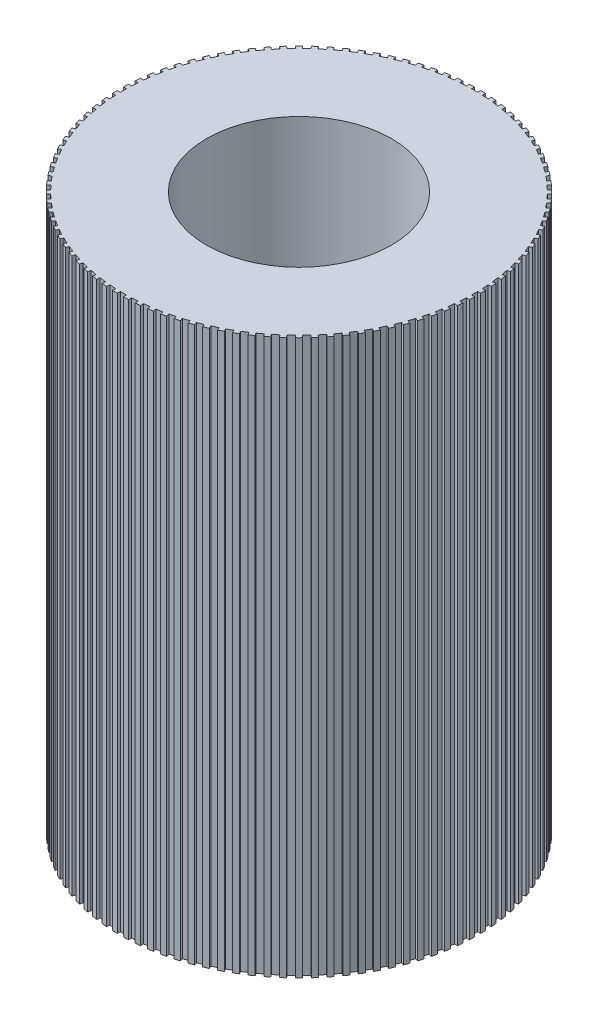
from build123d import *

# Parameters (mm, degrees)
SKETCH_1_R          = 2.9
SKETCH_1_R_2        = 1.5
EXTRUDE_1_DEPTH     = 9
SKETCH_2_W          = 0.1
SKETCH_2_H          = 0.1
CUT_EXTRUDE_1_DEPTH = 9


with BuildPart() as part:
    # 草图1 → 凸台-拉伸1 (new body)
    with BuildSketch(Plane(origin=(0, 0, 0), x_dir=(1, 0, 0), z_dir=(0, 1, 0))):
        Circle(SKETCH_1_R)
        Circle(SKETCH_1_R_2, mode=Mode.SUBTRACT)
    extrude(amount=EXTRUDE_1_DEPTH)

    # 草图2 → 切除-拉伸1 (cut)
    with BuildSketch(Plane(origin=(0, 9, 0), x_dir=(1, 0, 0), z_dir=(0, 1, 0))):
        Polygon((0.135330696, 2.947318375), (0.235133369, 2.941039323), (0.228854317, 2.84123665), (0.129051644, 2.847515702), align=None)
        with Locations((0, 2.9)):
            Rectangle(SKETCH_2_W, SKETCH_2_H)
        Polygon((0.320127304, 2.933005031), (0.419338774, 2.920471707), (0.406805451, 2.821260237), (0.307593981, 2.83379356), align=None)
        Polygon((0.503660515, 2.907116455), (0.601889241, 2.888378324), (0.583151109, 2.790149599), (0.484922384, 2.80888773), align=None)
        Polygon((0.685206009, 2.86975482), (0.782064325, 2.844885831), (0.757195336, 2.748027515), (0.66033702, 2.772896504), align=None)
        Polygon((0.864047308, 2.821067573), (0.959152959, 2.790165873), (0.92825126, 2.695060222), (0.833145608, 2.725961921), align=None)
        Polygon((1.039478606, 2.761246861), (1.132456255, 2.724434406), (1.095643799, 2.631456757), (1.002666151, 2.668269212), align=None)
        Polygon((1.210807557, 2.690528769), (1.301290263, 2.64795084), (1.258712334, 2.557468135), (1.168229628, 2.600046064), align=None)
        Polygon((1.377358005, 2.60919239), (1.464988673, 2.561017022), (1.416813305, 2.473386354), (1.329182637, 2.521561722), align=None)
        Polygon((1.538472649, 2.51755872), (1.622905441, 2.46397604), (1.569322762, 2.379543248), (1.484889969, 2.433125927), align=None)
        Polygon((1.693515645, 2.415989396), (1.774417344, 2.357210871), (1.715638819, 2.276309171), (1.634737119, 2.335087697), align=None)
        Polygon((1.841875108, 2.304885266), (1.918926432, 2.241142867), (1.855184033, 2.164091542), (1.778132709, 2.227833941), align=None)
        Polygon((1.982965531, 2.184684806), (2.055862394, 2.116230096), (1.987407683, 2.043333233), (1.914510821, 2.111787943), align=None)
        Polygon((2.116230096, 2.055862394), (2.184684806, 1.982965531), (2.111787943, 1.914510821), (2.043333233, 1.987407683), align=None)
        Polygon((2.241142867, 1.918926432), (2.304885266, 1.841875108), (2.227833941, 1.778132709), (2.164091542, 1.855184033), align=None)
        Polygon((2.357210871, 1.774417344), (2.415989396, 1.693515645), (2.335087697, 1.634737119), (2.276309171, 1.715638819), align=None)
        Polygon((2.46397604, 1.622905441), (2.51755872, 1.538472649), (2.433125927, 1.484889969), (2.379543248, 1.569322762), align=None)
        Polygon((2.561017022, 1.464988673), (2.60919239, 1.377358005), (2.521561722, 1.329182637), (2.473386354, 1.416813305), align=None)
        Polygon((2.64795084, 1.301290263), (2.690528769, 1.210807557), (2.600046064, 1.168229628), (2.557468135, 1.258712334), align=None)
        Polygon((2.724434406, 1.132456255), (2.761246861, 1.039478606), (2.668269212, 1.002666151), (2.631456757, 1.095643799), align=None)
        Polygon((2.790165873, 0.959152959), (2.821067573, 0.864047308), (2.725961921, 0.833145608), (2.695060222, 0.92825126), align=None)
        Polygon((2.844885831, 0.782064325), (2.86975482, 0.685206009), (2.772896504, 0.66033702), (2.748027515, 0.757195336), align=None)
        Polygon((2.888378324, 0.601889241), (2.907116455, 0.503660515), (2.80888773, 0.484922384), (2.790149599, 0.583151109), align=None)
        Polygon((2.920471707, 0.419338774), (2.933005031, 0.320127304), (2.83379356, 0.307593981), (2.821260237, 0.406805451), align=None)
        Polygon((2.941039323, 0.235133369), (2.947318375, 0.135330696), (2.847515702, 0.129051644), (2.84123665, 0.228854317), align=None)
        with Locations((2.9, 0)):
            Rectangle(SKETCH_2_W, SKETCH_2_H)
        Polygon((2.947318375, -0.135330696), (2.941039323, -0.235133369), (2.84123665, -0.228854317), (2.847515702, -0.129051644), align=None)
        Polygon((2.933005031, -0.320127304), (2.920471707, -0.419338774), (2.821260237, -0.406805451), (2.83379356, -0.307593981), align=None)
        Polygon((2.907116455, -0.503660515), (2.888378324, -0.601889241), (2.790149599, -0.583151109), (2.80888773, -0.484922384), align=None)
        Polygon((2.86975482, -0.685206009), (2.844885831, -0.782064325), (2.748027515, -0.757195336), (2.772896504, -0.66033702), align=None)
        Polygon((2.821067573, -0.864047308), (2.790165873, -0.959152959), (2.695060222, -0.92825126), (2.725961921, -0.833145608), align=None)
        Polygon((2.761246861, -1.039478606), (2.724434406, -1.132456255), (2.631456757, -1.095643799), (2.668269212, -1.002666151), align=None)
        Polygon((2.690528769, -1.210807557), (2.64795084, -1.301290263), (2.557468135, -1.258712334), (2.600046064, -1.168229628), align=None)
        Polygon((2.60919239, -1.377358005), (2.561017022, -1.464988673), (2.473386354, -1.416813305), (2.521561722, -1.329182637), align=None)
        Polygon((2.51755872, -1.538472649), (2.46397604, -1.622905441), (2.379543248, -1.569322762), (2.433125927, -1.484889969), align=None)
        Polygon((2.415989396, -1.693515645), (2.357210871, -1.774417344), (2.276309171, -1.715638819), (2.335087697, -1.634737119), align=None)
        Polygon((2.304885266, -1.841875108), (2.241142867, -1.918926432), (2.164091542, -1.855184033), (2.227833941, -1.778132709), align=None)
        Polygon((2.184684806, -1.982965531), (2.116230096, -2.055862394), (2.043333233, -1.987407683), (2.111787943, -1.914510821), align=None)
        Polygon((2.055862394, -2.116230096), (1.982965531, -2.184684806), (1.914510821, -2.111787943), (1.987407683, -2.043333233), align=None)
        Polygon((1.918926432, -2.241142867), (1.841875108, -2.304885266), (1.778132709, -2.227833941), (1.855184033, -2.164091542), align=None)
        Polygon((1.774417344, -2.357210871), (1.693515645, -2.415989396), (1.634737119, -2.335087697), (1.715638819, -2.276309171), align=None)
        Polygon((1.622905441, -2.46397604), (1.538472649, -2.51755872), (1.484889969, -2.433125927), (1.569322762, -2.379543248), align=None)
        Polygon((1.464988673, -2.561017022), (1.377358005, -2.60919239), (1.329182637, -2.521561722), (1.416813305, -2.473386354), align=None)
        Polygon((1.301290263, -2.64795084), (1.210807557, -2.690528769), (1.168229628, -2.600046064), (1.258712334, -2.557468135), align=None)
        Polygon((1.132456255, -2.724434406), (1.039478606, -2.761246861), (1.002666151, -2.668269212), (1.095643799, -2.631456757), align=None)
        Polygon((0.959152959, -2.790165873), (0.864047308, -2.821067573), (0.833145608, -2.725961921), (0.92825126, -2.695060222), align=None)
        Polygon((0.782064325, -2.844885831), (0.685206009, -2.86975482), (0.66033702, -2.772896504), (0.757195336, -2.748027515), align=None)
        Polygon((0.601889241, -2.888378324), (0.503660515, -2.907116455), (0.484922384, -2.80888773), (0.583151109, -2.790149599), align=None)
        Polygon((0.419338774, -2.920471707), (0.320127304, -2.933005031), (0.307593981, -2.83379356), (0.406805451, -2.821260237), align=None)
        Polygon((0.235133369, -2.941039323), (0.135330696, -2.947318375), (0.129051644, -2.847515702), (0.228854317, -2.84123665), align=None)
        with Locations((0, -2.9)):
            Rectangle(SKETCH_2_W, SKETCH_2_H)
        Polygon((-0.135330696, -2.947318375), (-0.235133369, -2.941039323), (-0.228854317, -2.84123665), (-0.129051644, -2.847515702), align=None)
        Polygon((-0.320127304, -2.933005031), (-0.419338774, -2.920471707), (-0.406805451, -2.821260237), (-0.307593981, -2.83379356), align=None)
        Polygon((-0.503660515, -2.907116455), (-0.601889241, -2.888378324), (-0.583151109, -2.790149599), (-0.484922384, -2.80888773), align=None)
        Polygon((-0.685206009, -2.86975482), (-0.782064325, -2.844885831), (-0.757195336, -2.748027515), (-0.66033702, -2.772896504), align=None)
        Polygon((-0.864047308, -2.821067573), (-0.959152959, -2.790165873), (-0.92825126, -2.695060222), (-0.833145608, -2.725961921), align=None)
        Polygon((-1.039478606, -2.761246861), (-1.132456255, -2.724434406), (-1.095643799, -2.631456757), (-1.002666151, -2.668269212), align=None)
        Polygon((-1.210807557, -2.690528769), (-1.301290263, -2.64795084), (-1.258712334, -2.557468135), (-1.168229628, -2.600046064), align=None)
        Polygon((-1.377358005, -2.60919239), (-1.464988673, -2.561017022), (-1.416813305, -2.473386354), (-1.329182637, -2.521561722), align=None)
        Polygon((-1.538472649, -2.51755872), (-1.622905441, -2.46397604), (-1.569322762, -2.379543248), (-1.484889969, -2.433125927), align=None)
        Polygon((-1.693515645, -2.415989396), (-1.774417344, -2.357210871), (-1.715638819, -2.276309171), (-1.634737119, -2.335087697), align=None)
        Polygon((-1.841875108, -2.304885266), (-1.918926432, -2.241142867), (-1.855184033, -2.164091542), (-1.778132709, -2.227833941), align=None)
        Polygon((-1.982965531, -2.184684806), (-2.055862394, -2.116230096), (-1.987407683, -2.043333233), (-1.914510821, -2.111787943), align=None)
        Polygon((-2.116230096, -2.055862394), (-2.184684806, -1.982965531), (-2.111787943, -1.914510821), (-2.043333233, -1.987407683), align=None)
        Polygon((-2.241142867, -1.918926432), (-2.304885266, -1.841875108), (-2.227833941, -1.778132709), (-2.164091542, -1.855184033), align=None)
        Polygon((-2.357210871, -1.774417344), (-2.415989396, -1.693515645), (-2.335087697, -1.634737119), (-2.276309171, -1.715638819), align=None)
        Polygon((-2.46397604, -1.622905441), (-2.51755872, -1.538472649), (-2.433125927, -1.484889969), (-2.379543248, -1.569322762), align=None)
        Polygon((-2.561017022, -1.464988673), (-2.60919239, -1.377358005), (-2.521561722, -1.329182637), (-2.473386354, -1.416813305), align=None)
        Polygon((-2.64795084, -1.301290263), (-2.690528769, -1.210807557), (-2.600046064, -1.168229628), (-2.557468135, -1.258712334), align=None)
        Polygon((-2.724434406, -1.132456255), (-2.761246861, -1.039478606), (-2.668269212, -1.002666151), (-2.631456757, -1.095643799), align=None)
        Polygon((-2.790165873, -0.959152959), (-2.821067573, -0.864047308), (-2.725961921, -0.833145608), (-2.695060222, -0.92825126), align=None)
        Polygon((-2.844885831, -0.782064325), (-2.86975482, -0.685206009), (-2.772896504, -0.66033702), (-2.748027515, -0.757195336), align=None)
        Polygon((-2.888378324, -0.601889241), (-2.907116455, -0.503660515), (-2.80888773, -0.484922384), (-2.790149599, -0.583151109), align=None)
        Polygon((-2.920471707, -0.419338774), (-2.933005031, -0.320127304), (-2.83379356, -0.307593981), (-2.821260237, -0.406805451), align=None)
        Polygon((-2.941039323, -0.235133369), (-2.947318375, -0.135330696), (-2.847515702, -0.129051644), (-2.84123665, -0.228854317), align=None)
        with Locations((-2.9, 0)):
            Rectangle(SKETCH_2_W, SKETCH_2_H)
        Polygon((-2.947318375, 0.135330696), (-2.941039323, 0.235133369), (-2.84123665, 0.228854317), (-2.847515702, 0.129051644), align=None)
        Polygon((-2.933005031, 0.320127304), (-2.920471707, 0.419338774), (-2.821260237, 0.406805451), (-2.83379356, 0.307593981), align=None)
        Polygon((-2.907116455, 0.503660515), (-2.888378324, 0.601889241), (-2.790149599, 0.583151109), (-2.80888773, 0.484922384), align=None)
        Polygon((-2.86975482, 0.685206009), (-2.844885831, 0.782064325), (-2.748027515, 0.757195336), (-2.772896504, 0.66033702), align=None)
        Polygon((-2.821067573, 0.864047308), (-2.790165873, 0.959152959), (-2.695060222, 0.92825126), (-2.725961921, 0.833145608), align=None)
        Polygon((-2.761246861, 1.039478606), (-2.724434406, 1.132456255), (-2.631456757, 1.095643799), (-2.668269212, 1.002666151), align=None)
        Polygon((-2.690528769, 1.210807557), (-2.64795084, 1.301290263), (-2.557468135, 1.258712334), (-2.600046064, 1.168229628), align=None)
        Polygon((-2.60919239, 1.377358005), (-2.561017022, 1.464988673), (-2.473386354, 1.416813305), (-2.521561722, 1.329182637), align=None)
        Polygon((-2.51755872, 1.538472649), (-2.46397604, 1.622905441), (-2.379543248, 1.569322762), (-2.433125927, 1.484889969), align=None)
        Polygon((-2.415989396, 1.693515645), (-2.357210871, 1.774417344), (-2.276309171, 1.715638819), (-2.335087697, 1.634737119), align=None)
        Polygon((-2.304885266, 1.841875108), (-2.241142867, 1.918926432), (-2.164091542, 1.855184033), (-2.227833941, 1.778132709), align=None)
        Polygon((-2.184684806, 1.982965531), (-2.116230096, 2.055862394), (-2.043333233, 1.987407683), (-2.111787943, 1.914510821), align=None)
        Polygon((-2.055862394, 2.116230096), (-1.982965531, 2.184684806), (-1.914510821, 2.111787943), (-1.987407683, 2.043333233), align=None)
        Polygon((-1.918926432, 2.241142867), (-1.841875108, 2.304885266), (-1.778132709, 2.227833941), (-1.855184033, 2.164091542), align=None)
        Polygon((-1.774417344, 2.357210871), (-1.693515645, 2.415989396), (-1.634737119, 2.335087697), (-1.715638819, 2.276309171), align=None)
        Polygon((-1.622905441, 2.46397604), (-1.538472649, 2.51755872), (-1.484889969, 2.433125927), (-1.569322762, 2.379543248), align=None)
        Polygon((-1.464988673, 2.561017022), (-1.377358005, 2.60919239), (-1.329182637, 2.521561722), (-1.416813305, 2.473386354), align=None)
        Polygon((-1.301290263, 2.64795084), (-1.210807557, 2.690528769), (-1.168229628, 2.600046064), (-1.258712334, 2.557468135), align=None)
        Polygon((-1.132456255, 2.724434406), (-1.039478606, 2.761246861), (-1.002666151, 2.668269212), (-1.095643799, 2.631456757), align=None)
        Polygon((-0.959152959, 2.790165873), (-0.864047308, 2.821067573), (-0.833145608, 2.725961921), (-0.92825126, 2.695060222), align=None)
        Polygon((-0.782064325, 2.844885831), (-0.685206009, 2.86975482), (-0.66033702, 2.772896504), (-0.757195336, 2.748027515), align=None)
        Polygon((-0.601889241, 2.888378324), (-0.503660515, 2.907116455), (-0.484922384, 2.80888773), (-0.583151109, 2.790149599), align=None)
        Polygon((-0.419338774, 2.920471707), (-0.320127304, 2.933005031), (-0.307593981, 2.83379356), (-0.406805451, 2.821260237), align=None)
        Polygon((-0.235133369, 2.941039323), (-0.135330696, 2.947318375), (-0.129051644, 2.847515702), (-0.228854317, 2.84123665), align=None)
    extrude(amount=-CUT_EXTRUDE_1_DEPTH, mode=Mode.SUBTRACT)


solid = part.part
